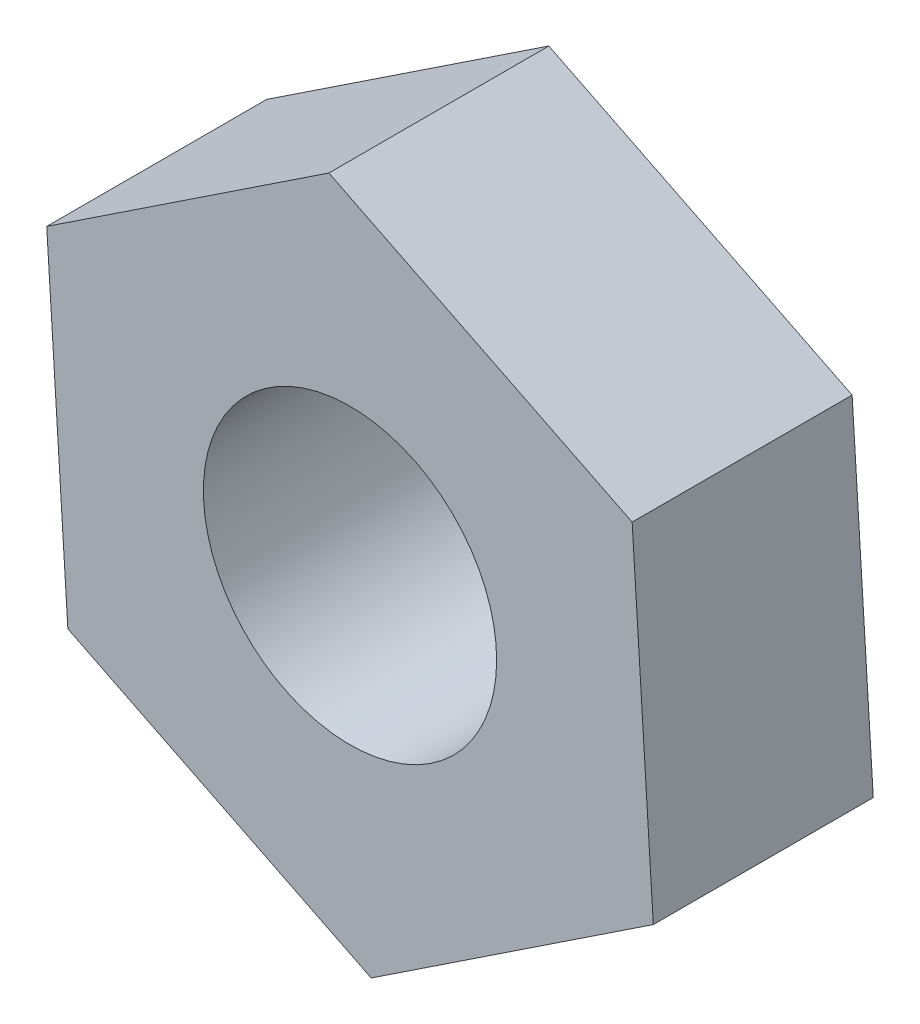
from build123d import *

# Parameters (mm, degrees)
BOSS_EXTRUDE1_DEPTH = 1.5
SKETCH2_R           = 1
CUT_EXTRUDE1_DEPTH  = 4.44094223


with BuildPart() as part:
    # Sketch1 → Boss-Extrude1 (new body)
    with BuildSketch(Plane.XY):
        Polygon((-1.923960579, -1.277383663), (0.144266413, -2.304890569), (2.068226992, -1.027506906), (1.923960579, 1.277383663), (-0.144266413, 2.304890569), (-2.068226992, 1.027506906), align=None)
    extrude(amount=BOSS_EXTRUDE1_DEPTH)

    # Sketch2 → Cut-Extrude1 (cut, through all)
    with BuildSketch(Plane.XY.offset(1.5)):
        Circle(SKETCH2_R)
    extrude(amount=-CUT_EXTRUDE1_DEPTH, mode=Mode.SUBTRACT)


solid = part.part
